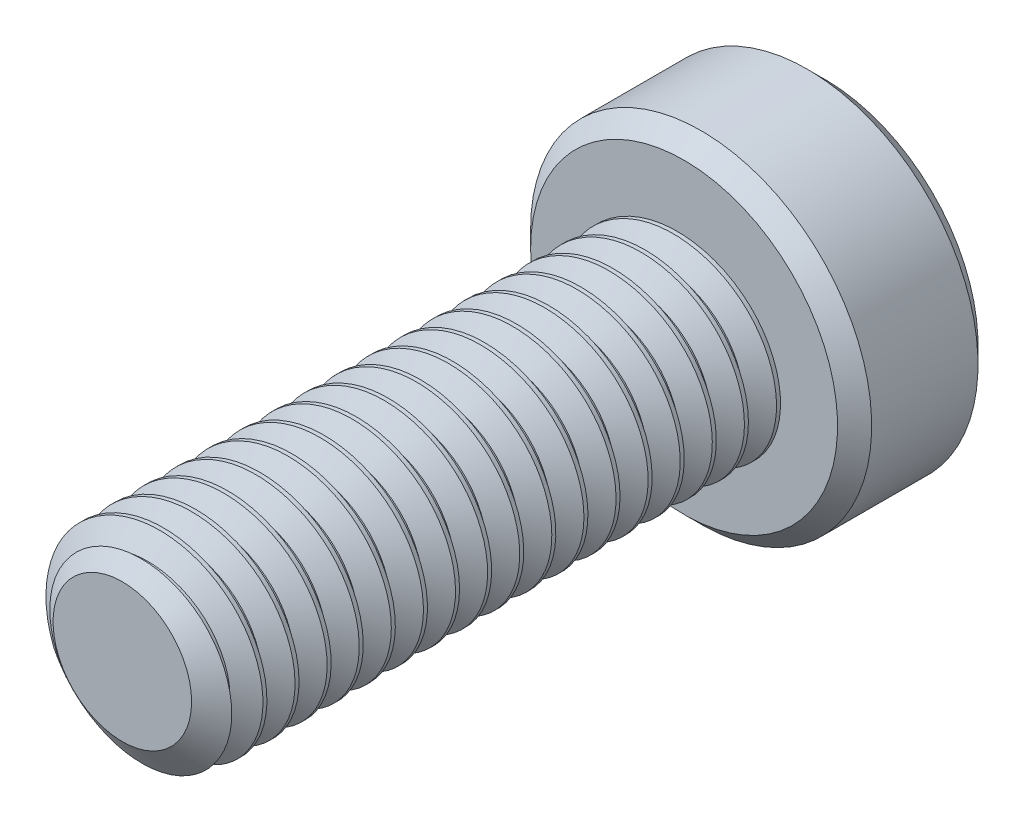
from build123d import *

# Parameters (mm, degrees)
SKETCH1_R          = 2.5
EXTRUDE1_DEPTH     = 14
CUT_SWEEP1_PITCH   = 0.8
SKETCH6_R          = 4.25
EXTRUDE2_DEPTH     = 3.5
CUT_EXTRUDE1_DEPTH = 2.25
CHAMFER1_SIZE      = 0.425


with BuildPart() as part:
    # Sketch1 → Extrude1 (new body)
    with BuildSketch(Plane.XY):
        Circle(SKETCH1_R)
    extrude(amount=-EXTRUDE1_DEPTH)

    # Cut-Sweep1: the profile of Sketch3 profile screwed along a right-hand helix of 18.5 turns, 6 arcs to a turn; built about Z, then put on its axis
    cut_sweep1_z = Axis((0, 0, 0), (0, 0, 1))
    cut_sweep1_corners = [(2.5003, 0, -0.700173205), (1.980384758, 0, -0.4), (1.980384758, 0, -0.3), (2.5003, 0, 0.000173205)]
    with BuildLine(mode=Mode.PRIVATE) as cut_sweep1_profile:
        Line(cut_sweep1_corners[0], cut_sweep1_corners[1])
        Line(cut_sweep1_corners[1], cut_sweep1_corners[2])
        Line(cut_sweep1_corners[2], cut_sweep1_corners[3])
        Line(cut_sweep1_corners[3], cut_sweep1_corners[0])
    cut_sweep1_cap = Face(cut_sweep1_profile.wire())
    cut_sweep1_turn_angles = [0, 30, 60, 90, 120, 150, 180, 210, 240, 270, 300, 330, 360]
    cut_sweep1_turn_weights = [1, 0.8660254037844387, 1, 0.8660254037844387, 1, 0.8660254037844387, 1, 0.8660254037844387, 1, 0.8660254037844387, 1, 0.8660254037844387, 1]
    cut_sweep1_turn_rails = [Edge.make_bspline([Vector(p[0], p[1], 0).rotate(cut_sweep1_z, cut_sweep1_turn_angles[k]) / cut_sweep1_turn_weights[k] + Vector(0, 0, p[2] + CUT_SWEEP1_PITCH * cut_sweep1_turn_angles[k] / 360) for k in range(13)], [0, 0, 0, 1, 1, 2, 2, 3, 3, 4, 4, 5, 5, 6, 6, 6], 2, cut_sweep1_turn_weights) for p in cut_sweep1_corners]
    cut_sweep1_turn_sides = [Face.make_surface_from_curves(cut_sweep1_turn_rails[p[0]], cut_sweep1_turn_rails[p[1]]) for p in [(0, 1), (1, 2), (2, 3), (3, 0)]]
    cut_sweep1_last_angles = [6480, 6510, 6540, 6570, 6600, 6630, 6660]
    cut_sweep1_last_weights = [1, 0.8660254037844387, 1, 0.8660254037844387, 1, 0.8660254037843871, 1]
    cut_sweep1_last_rails = [Edge.make_bspline([Vector(p[0], p[1], 0).rotate(cut_sweep1_z, cut_sweep1_last_angles[k]) / cut_sweep1_last_weights[k] + Vector(0, 0, p[2] + CUT_SWEEP1_PITCH * cut_sweep1_last_angles[k] / 360) for k in range(7)], [0, 0, 0, 1, 1, 2, 2, 3, 3, 3], 2, cut_sweep1_last_weights) for p in cut_sweep1_corners]
    cut_sweep1_last_sides = [Face.make_surface_from_curves(cut_sweep1_last_rails[p[0]], cut_sweep1_last_rails[p[1]]) for p in [(0, 1), (1, 2), (2, 3), (3, 0)]]
    cut_sweep1 = Plane(origin=(0, 0, 0), x_dir=(0, 1, 0), z_dir=(0, 0, -1)) * Solid(Shell([*[p.moved(Location((0, 0, CUT_SWEEP1_PITCH * i))) for i in range(18) for p in cut_sweep1_turn_sides], *cut_sweep1_last_sides, cut_sweep1_cap, cut_sweep1_cap.rotate(cut_sweep1_z, 6660).moved(Location((0, 0, CUT_SWEEP1_PITCH * 6660 / 360)))]))
    add(cut_sweep1, mode=Mode.SUBTRACT)

    # Sketch4 → Cut-Revolve1 (revolve, cut)
    with BuildSketch(Plane(origin=(0, 0, 0), x_dir=(0, 0, -1), z_dir=(1, 0, 0)), mode=Mode.PRIVATE) as cut_revolve1_sk:
        Polygon((0.541691224, 2.5), (0, 1.726384758), (0, 2.5), align=None)
    revolve(cut_revolve1_sk.sketch.rotate(Axis((0, 0, 0), (0, 0, -1)), 260.43858876), axis=Axis((0, 0, 0), (0, 0, -1)), mode=Mode.SUBTRACT)

    # Sketch6 → Extrude2 (add)
    with BuildSketch(Plane(origin=(0, 0, -14), x_dir=(-1, 0, 0), z_dir=(0, 0, -1))):
        Circle(SKETCH6_R)
    extrude(amount=EXTRUDE2_DEPTH)

    # Sketch7 → Cut-Extrude1 (cut)
    with BuildSketch(Plane(origin=(0, 0, -17.5), x_dir=(-1, 0, 0), z_dir=(0, 0, -1))):
        Polygon((0, 1.732050808), (-1.5, 0.866025404), (-1.5, -0.866025404), (0, -1.732050808), (1.5, -0.866025404), (1.5, 0.866025404), align=None)
    extrude(amount=-CUT_EXTRUDE1_DEPTH, mode=Mode.SUBTRACT)

    # Cut-Extrude2 cone 1 section (through the dimple's axis) → Cut-Extrude2 (revolve, cut)
    with BuildSketch(Plane(origin=(0, 0, -17.5), x_dir=(0, 1, 0), z_dir=(1, 0, 0))):
        Polygon((0, 0), (1.732050808, 0), (0, 1.732050808), align=None)
    revolve(axis=Axis((0, 0, -17.5), (0, 0, 1)), mode=Mode.SUBTRACT)

    # Chamfer1
    chamfer1_edges = [part.edges().sort_by_distance(p)[0] for p in [
        (4.25, 0, -14),
        (4.25, 0, -17.5),
    ]]
    chamfer(chamfer1_edges, length=CHAMFER1_SIZE)


solid = part.part
